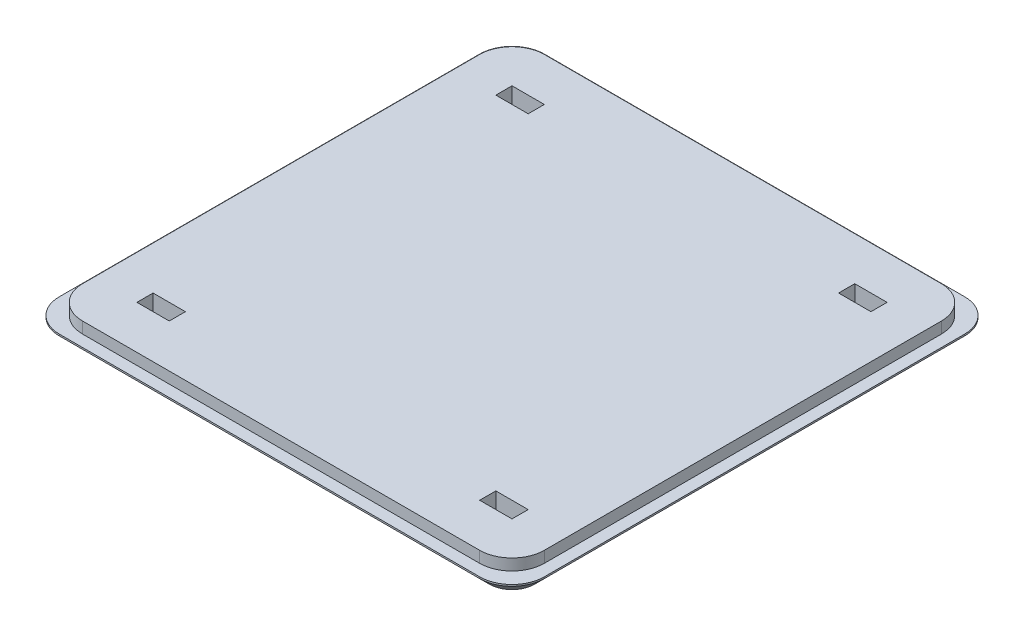
from build123d import *

# Parameters (mm, degrees)
SKETCH1_W           = 150
SKETCH1_H           = 150
BOSS_EXTRUDE1_DEPTH = 3.5
SKETCH2_W           = 142.8
SKETCH2_H           = 142.8
BOSS_EXTRUDE2_DEPTH = 3.5
FILLET9_R           = 10
FILLET10_R          = 10
CHAMFER3_SIZE       = 3
SKETCH3_W           = 10
SKETCH3_H           = 5
CUT_EXTRUDE1_DEPTH  = 10
SKETCH4_W           = 10
SKETCH4_H           = 5
CUT_EXTRUDE2_DEPTH  = 10
SKETCH5_W           = 10
SKETCH5_H           = 5
CUT_EXTRUDE3_DEPTH  = 10
SKETCH6_W           = 10
SKETCH6_H           = 5
CUT_EXTRUDE4_DEPTH  = 10


with BuildPart() as part:
    # Sketch1 → Boss-Extrude1 (new body)
    with BuildSketch(Plane(origin=(0, 0, 0), x_dir=(1, 0, 0), z_dir=(0, 1, 0))):
        with Locations((75, 75)):
            Rectangle(SKETCH1_W, SKETCH1_H)
    extrude(amount=BOSS_EXTRUDE1_DEPTH)

    # Sketch2 → Boss-Extrude2 (add)
    with BuildSketch(Plane(origin=(0, 3.5, 0), x_dir=(1, 0, 0), z_dir=(0, 1, 0))):
        with Locations((75, 75)):
            Rectangle(SKETCH2_W, SKETCH2_H)
    extrude(amount=BOSS_EXTRUDE2_DEPTH)

    # Fillet9
    fillet9_edges = [part.edges().sort_by_distance(p)[0] for p in [
        (146.4, 5.25, -3.6),
        (150, 1.75, 0),
    ]]
    fillet(fillet9_edges, radius=FILLET9_R)

    # Fillet10
    fillet10_edges = [part.edges().sort_by_distance(p)[0] for p in [
        (0, 1.75, -150),
        (3.6, 5.25, -146.4),
        (0, 1.75, 0),
        (3.6, 5.25, -3.6),
        (146.4, 5.25, -146.4),
        (150, 1.75, -150),
    ]]
    fillet(fillet10_edges, radius=FILLET10_R)

    # Chamfer3
    chamfer3_edges = [part.edges().sort_by_distance(p)[0] for p in [
        (150, 0, -75),
        (147.071067812, 0, -147.071067812),
        (75, 0, -150),
        (2.928932188, 0, -147.071067812),
        (147.071067812, 0, -2.928932188),
        (0, 0, -75),
        (2.928932188, 0, -2.928932188),
        (75, 0, 0),
    ]]
    chamfer(chamfer3_edges, length=CHAMFER3_SIZE)

    # Sketch3 → Cut-Extrude1 (cut)
    with BuildSketch(Plane(origin=(0, 7, 0), x_dir=(1, 0, 0), z_dir=(0, 1, 0))):
        with Locations((22, 19.5)):
            Rectangle(SKETCH3_W, SKETCH3_H)
    extrude(amount=-CUT_EXTRUDE1_DEPTH, mode=Mode.SUBTRACT)

    # Sketch4 → Cut-Extrude2 (cut)
    with BuildSketch(Plane(origin=(0, 7, 0), x_dir=(1, 0, 0), z_dir=(0, 1, 0))):
        with Locations((22, 130.5)):
            Rectangle(SKETCH4_W, SKETCH4_H)
    extrude(amount=-CUT_EXTRUDE2_DEPTH, mode=Mode.SUBTRACT)

    # Sketch5 → Cut-Extrude3 (cut)
    with BuildSketch(Plane(origin=(0, 7, 0), x_dir=(1, 0, 0), z_dir=(0, 1, 0))):
        with Locations((128, 19.5)):
            Rectangle(SKETCH5_W, SKETCH5_H)
    extrude(amount=-CUT_EXTRUDE3_DEPTH, mode=Mode.SUBTRACT)

    # Sketch6 → Cut-Extrude4 (cut)
    with BuildSketch(Plane(origin=(0, 7, 0), x_dir=(1, 0, 0), z_dir=(0, 1, 0))):
        with Locations((128, 130.5)):
            Rectangle(SKETCH6_W, SKETCH6_H)
    extrude(amount=-CUT_EXTRUDE4_DEPTH, mode=Mode.SUBTRACT)


solid = part.part
